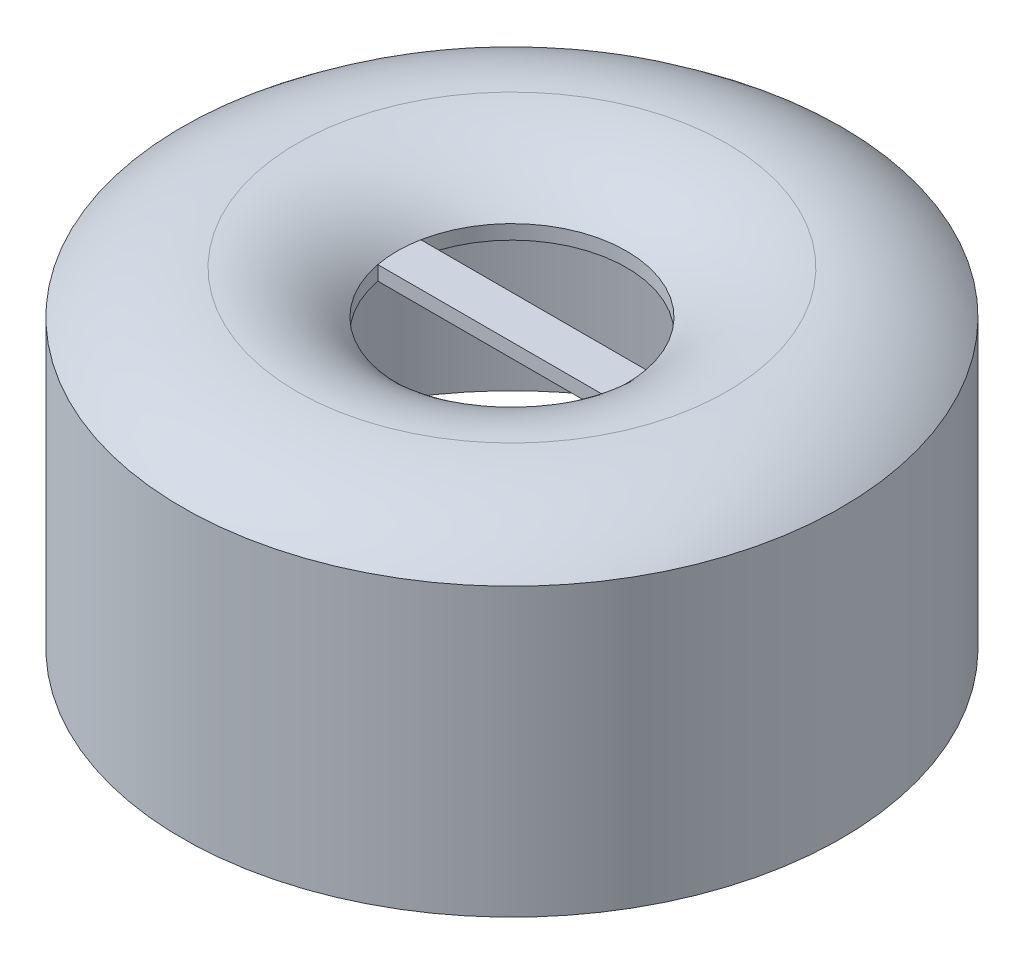
from build123d import *

# Parameters (mm, degrees)
CORTAR_EXTRUIR1_DEPTH = 10
CROQUIS3_R            = 11
CORTAR_EXTRUIR3_DEPTH = 9.5


# Read off the part's stored shape, not the designer's step: Vaciado4
with BuildPart() as part:
    # Croquis1 → Revolución1 (revolve)
    with BuildSketch(Plane.XY, mode=Mode.PRIVATE) as revoluci_n1_sk:
        with BuildLine():
            Line((-22.7696793, 0), (-22.7696793, 10))
            ThreePointArc((-22.7696793, 10), (-20.905680237, 11.112669164), (-18.7696793, 11.5))
            ThreePointArc((-18.7696793, 11.5), (-16.865736024, 11.109200978), (-15.2696793, 10))
            Line((-15.2696793, 10), (-11.2696793, 10))
            Line((-11.2696793, 10), (-11.2696793, 0))
            Line((-11.2696793, 0), (-22.7696793, 0))
        make_face()
    revolve(revoluci_n1_sk.sketch.rotate(Axis((-11.2696793, 0, 0), (0, 1, 0)), 270), axis=Axis((-11.2696793, 0, 0), (0, 1, 0)))

    # Croquis2 → Cortar-Extruir1 (cut)
    with BuildSketch(Plane(origin=(0, 10, 0), x_dir=(1, 0, 0), z_dir=(0, 1, 0))):
        with BuildLine():
            Line((-15.198737712, 0.75), (-7.340620889, 0.75))
            ThreePointArc((-7.340620889, 0.75), (-11.2696793, 4), (-15.198737712, 0.75))
        make_face()
        with BuildLine():
            Line((-15.198737712, -0.75), (-7.340620889, -0.75))
            ThreePointArc((-7.340620889, -0.75), (-11.2696793, -4), (-15.198737712, -0.75))
        make_face()
    extrude(amount=-CORTAR_EXTRUIR1_DEPTH, mode=Mode.SUBTRACT)

    # Croquis3 → Cortar-Extruir3 (cut)
    with BuildSketch(Plane.XZ):
        with Locations(Location((-11.2696793, 0, 0), (0, 0, 270))):
            Circle(CROQUIS3_R)
    extrude(amount=-CORTAR_EXTRUIR3_DEPTH, mode=Mode.SUBTRACT)

    # Vaciado4 outline → Vaciado4 (revolve, cut)
    with BuildSketch(Plane(origin=(-11.2696793, 0, 0), x_dir=(1, 0, 0), z_dir=(0, 0, 1))):
        with BuildLine():
            Line((10.5, 9.5), (10.5, 9.520357417))
            ThreePointArc((10.5, 9.520357417), (9.077949586, 10.248886951), (7.5, 10.5))
            ThreePointArc((7.5, 10.5), (6.166764081, 10.260679247), (5, 9.572599296))
            Line((5, 9.572599296), (5, 9.5))
            Line((5, 9.5), (10.5, 9.5))
        make_face()
    revolve(axis=Axis((-11.2696793, 0, 0), (0, 1, 0)), mode=Mode.SUBTRACT)


solid = part.part
